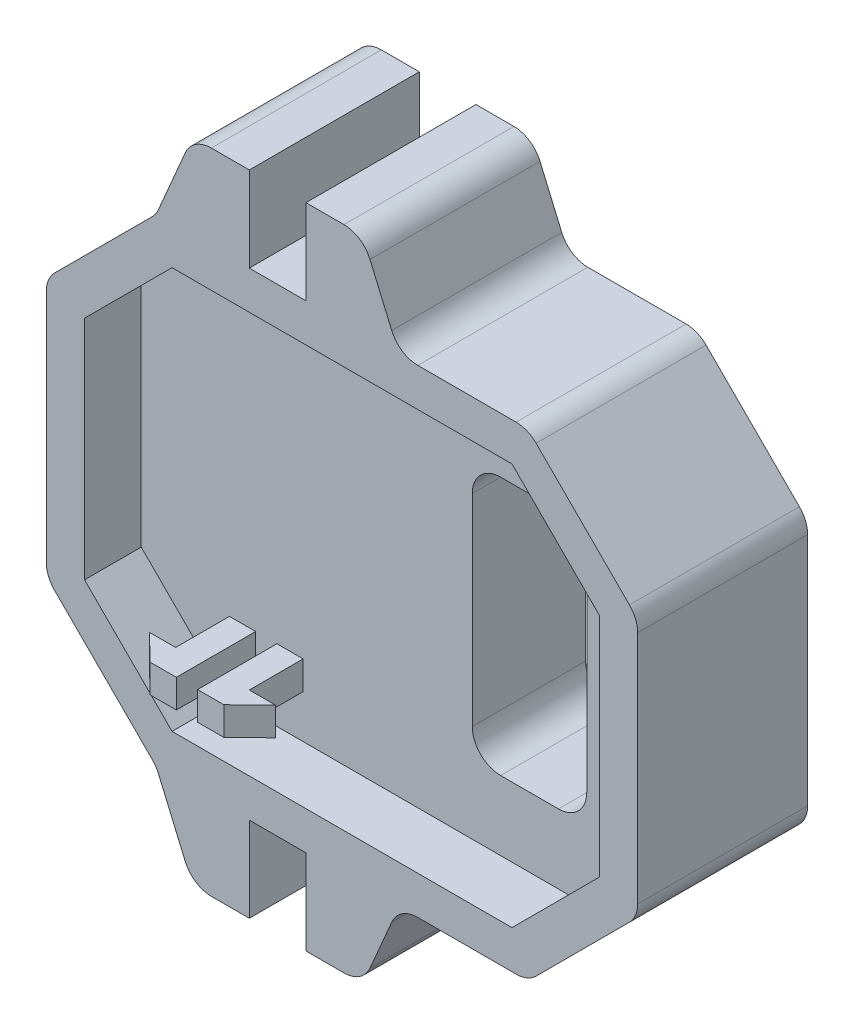
from build123d import *

# Parameters (mm, degrees)
BOSS_EXTRU_1_DEPTH   = 2
ESQUISSE2_W          = 4.04
ESQUISSE2_H          = 9.12
BOSS_EXTRU_2_DEPTH   = 4
BOSS_EXTRU_3_DEPTH   = 0.5
BOSS_EXTRU_3_2_DEPTH = 0.5
COQUE1_START         = -6
COQUE1_DEPTH         = 2.5
COQUE1_START_2       = -3.5
COQUE1_2_DEPTH       = 2
CONG_1_R             = 1
NERVURE1_REACH       = 28.137
ESQUISSE5_WALLS_W    = 1.5
ESQUISSE5_WALLS_H    = 68.146214938
NERVURE2_START       = -2.5
NERVURE2_OUTLINE_W   = 5.915
NERVURE2_OUTLINE_H   = 1.5
NERVURE2_OUTLINE_W_2 = 2.62
NERVURE2_DEPTH       = 2.5


# Read off the part's stored shape, not the designer's step: Coque1, Nervure2
with BuildPart() as part:
    # Esquisse1 → Boss.-Extru.1 (new body)
    with BuildSketch(Plane.XY):
        Polygon((2.008, 0.600679656), (2.008, 9.716320344), (-1.870679656, 13.595), (-6.413679656, 13.595), (-7.7, 16.595), (-9.7, 16.595), (-9.7, 13.595), (-11.7, 13.595), (-11.7, 16.595), (-13.7, 16.595), (-14.986320344, 13.595), (-18.865, 9.716320344), (-18.865, 0.600679656), (-14.986320344, -3.278), (-13.7, -6.278), (-11.7, -6.278), (-11.7, -3.278), (-9.7, -3.278), (-9.7, -6.278), (-7.7, -6.278), (-6.413679656, -3.278), (-1.870679656, -3.278), align=None)
        Polygon((0.658, 1.159867966), (0.658, 9.157132034), (-2.429867966, 12.245), (-14.427132034, 12.245), (-17.515, 9.157132034), (-17.515, 1.159867966), (-14.427132034, -1.928), (-2.429867966, -1.928), align=None, mode=Mode.SUBTRACT)
    extrude(amount=-BOSS_EXTRU_1_DEPTH)

    # Esquisse2 → Boss.-Extru.2 (add)
    with BuildSketch(Plane(origin=(0, 0, -2), x_dir=(-1, 0, 0), z_dir=(0, 0, -1))):
        Polygon((-2.008, 0.600679656), (1.870679656, -3.278), (6.413679656, -3.278), (7.7, -6.278), (9.7, -6.278), (9.7, -3.278), (11.7, -3.278), (11.7, -6.278), (13.7, -6.278), (14.986320344, -3.278), (18.865, 0.600679656), (18.865, 9.716320344), (14.986320344, 13.595), (13.7, 16.595), (11.7, 16.595), (11.7, 13.595), (9.7, 13.595), (9.7, 16.595), (7.7, 16.595), (6.413679656, 13.595), (1.870679656, 13.595), (-2.008, 9.716320344), align=None)
        with Locations((3.81, 5.08)):
            Rectangle(ESQUISSE2_W, ESQUISSE2_H, mode=Mode.SUBTRACT)
    extrude(amount=BOSS_EXTRU_2_DEPTH)

    # Coque1 outline → Coque1 (cut)
    with BuildSketch(Plane.XY.offset(COQUE1_START)):
        Polygon((-7.33, -0.98), (-7.33, 11.14), (-1.537, 11.14), (-2.492, 12.095), (-7.402590257, 12.095), (-8.2, 13.954746089), (-8.2, 12.095), (-13.2, 12.095), (-13.2, 13.954746089), (-13.721489547, 12.738510453), (-17.365, 9.095), (-17.365, 1.222), (-13.721489547, -2.421510453), (-13.2, -3.637746089), (-13.2, -1.778), (-8.2, -1.778), (-8.2, -3.637746089), (-7.402590257, -1.778), (-2.492, -1.778), (-1.694, -0.98), align=None)
        Polygon((-0.29, 9.893), (-0.29, 0.424), (0.508, 1.222), (0.508, 9.095), align=None)
    extrude(amount=COQUE1_DEPTH, mode=Mode.SUBTRACT)

    # Coque1 2 outline → Coque1 2 (cut)
    with BuildSketch(Plane.XY.offset(COQUE1_START_2)):
        Polygon((-8.2, 13.745), (-8.110066446, 13.745), (-8.2, 13.954746089), align=None)
        Polygon((-8.2, -3.637746089), (-8.110066446, -3.428), (-8.2, -3.428), align=None)
        Polygon((-13.289933554, 13.745), (-13.2, 13.745), (-13.2, 13.954746089), align=None)
        Polygon((-13.2, -3.637746089), (-13.2, -3.428), (-13.289933554, -3.428), align=None)
    extrude(amount=COQUE1_2_DEPTH, mode=Mode.SUBTRACT)

    # Congé1
    cong_1_edges = [part.edges().sort_by_distance(p)[0] for p in [
        (-1.79, 0.52, -4),
        (-5.83, 0.52, -4),
        (-5.83, 9.64, -4),
        (-1.79, 9.64, -4),
        (0.508, 1.222, -4.75),
        (0.508, 9.095, -4.75),
        (-7.33, 11.14, -4.75),
        (-7.33, -0.98, -4.75),
        (-8.2, 12.095, -4.75),
        (-13.721489547, 12.738510453, -4.75),
        (-17.365, 1.222, -4.75),
        (-13.2, -1.778, -4.75),
        (-7.402590257, -1.778, -4.75),
        (-2.492, 12.095, -4.75),
        (-2.492, -1.778, -4.75),
        (-7.402590257, 12.095, -4.75),
        (-8.2, -1.778, -4.75),
        (-13.721489547, -2.421510453, -4.75),
        (-13.2, 12.095, -4.75),
        (-17.365, 9.095, -4.75),
        (-1.870679656, -3.278, -3),
        (-6.413679656, -3.278, -3),
        (-7.7, -6.278, -3),
        (-13.7, -6.278, -3),
        (-14.986320344, -3.278, -3),
        (-18.865, 0.600679656, -3),
        (-18.865, 9.716320344, -3),
        (-14.986320344, 13.595, -3),
        (-13.7, 16.595, -3),
        (-7.7, 16.595, -3),
        (-6.413679656, 13.595, -3),
        (-1.870679656, 13.595, -3),
        (2.008, 9.716320344, -3),
        (2.008, 0.600679656, -3),
    ]]
    fillet(cong_1_edges, radius=CONG_1_R)

    # Esquisse5 walls → Nervure1 (add, up to next)
    with BuildSketch(Plane(origin=(0, 0, -6), x_dir=(-1, 0, 0), z_dir=(0, 0, -1)), mode=Mode.PRIVATE) as nervure1_sk1:
        with Locations((10.7, 5.1585)):
            Rectangle(ESQUISSE5_WALLS_W, ESQUISSE5_WALLS_H)
    nervure1_tool1 = extrude(nervure1_sk1.sketch, amount=-NERVURE1_REACH, mode=Mode.PRIVATE) - part.part
    add(nervure1_tool1.solids().sort_by_distance((-10.7, 5.1585, -6))[0])

    # Nervure2 outline → Nervure2 (add)
    with BuildSketch(Plane(origin=(0, 0, -6), x_dir=(-1, 0, 0), z_dir=(0, 0, -1)).offset(NERVURE2_START)):
        with Locations((14.4075, 5.08)):
            Rectangle(NERVURE2_OUTLINE_W, NERVURE2_OUTLINE_H)
        with Locations((8.64, 5.08)):
            Rectangle(NERVURE2_OUTLINE_W_2, NERVURE2_OUTLINE_H)
    extrude(amount=NERVURE2_DEPTH)


with BuildPart() as body_2:
    # Esquisse4 → Boss.-Extru.3 (new, symmetric)
    with BuildSketch(Plane(origin=(0, 0.5, 0), x_dir=(-1, 0, 0), z_dir=(0, -1, 0))):
        Polygon((12.325, -1.2), (12.325, 1.6), (11.4, 1.6), (11.4, -0.3), (10.475, -0.3), (11.4, -1.2), align=None)
    extrude(amount=BOSS_EXTRU_3_DEPTH, both=True)


with BuildPart() as body_3:
    # Esquisse4 → Boss.-Extru.3 2 (new, symmetric)
    with BuildSketch(Plane(origin=(0, 0.5, 0), x_dir=(-1, 0, 0), z_dir=(0, -1, 0))):
        Polygon((14, -0.3), (14, 1.6), (13.075, 1.6), (13.075, -1.2), (14, -1.2), (14.925, -0.3), align=None)
    extrude(amount=BOSS_EXTRU_3_2_DEPTH, both=True)


solid = Compound([part.part, body_2.part, body_3.part])
